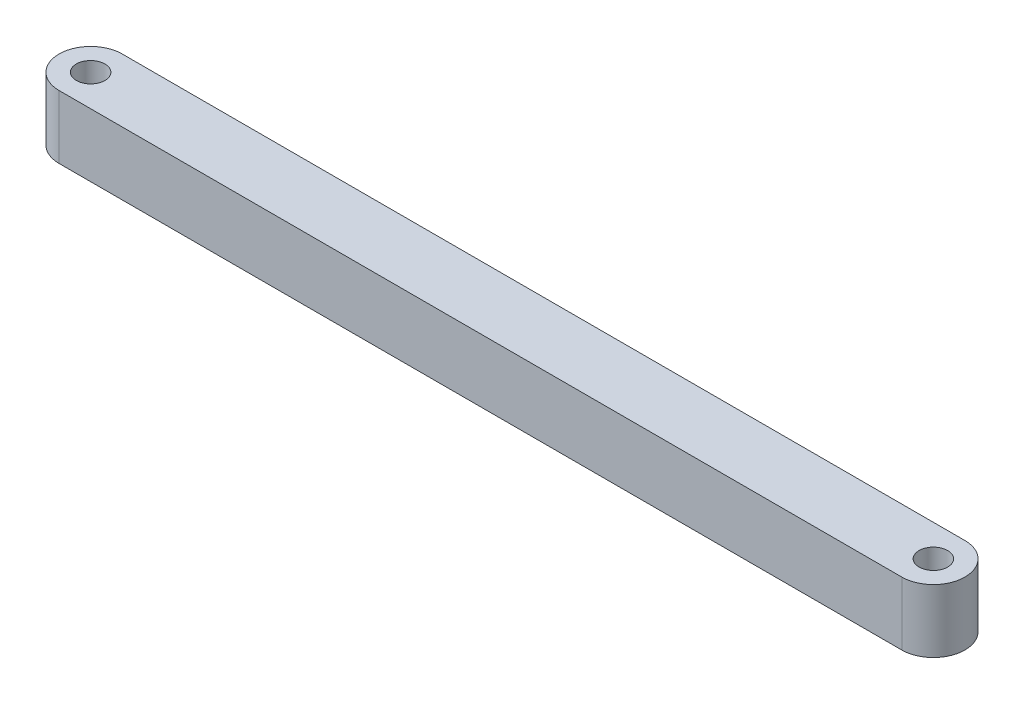
from build123d import *

# Parameters (mm, degrees)
BOSS_EXTRUDE1_DEPTH = 4.7625
SKETCH2_R           = 2.159
CUT_EXTRUDE1_DEPTH  = 133.192145899


with BuildPart() as part:
    # Sketch1 → Boss-Extrude1 (new, symmetric)
    with BuildSketch(Plane(origin=(0, 0, 0), x_dir=(1, 0, 0), z_dir=(0, 1, 0))):
        with BuildLine():
            Line((0, 4.7625), (127, 4.7625))
            ThreePointArc((127, 4.7625), (131.7625, 0), (127, -4.7625))
            Line((127, -4.7625), (0, -4.7625))
            ThreePointArc((0, -4.7625), (-4.7625, 0), (0, 4.7625))
        make_face()
    extrude(amount=BOSS_EXTRUDE1_DEPTH, both=True)

    # Sketch2 → Cut-Extrude1 (cut, through all)
    with BuildSketch(Plane(origin=(0, 4.7625, 0), x_dir=(1, 0, 0), z_dir=(0, 1, 0))):
        Circle(SKETCH2_R)
        with Locations((127, 0)):
            Circle(SKETCH2_R)
    extrude(amount=-CUT_EXTRUDE1_DEPTH, mode=Mode.SUBTRACT)


solid = part.part
